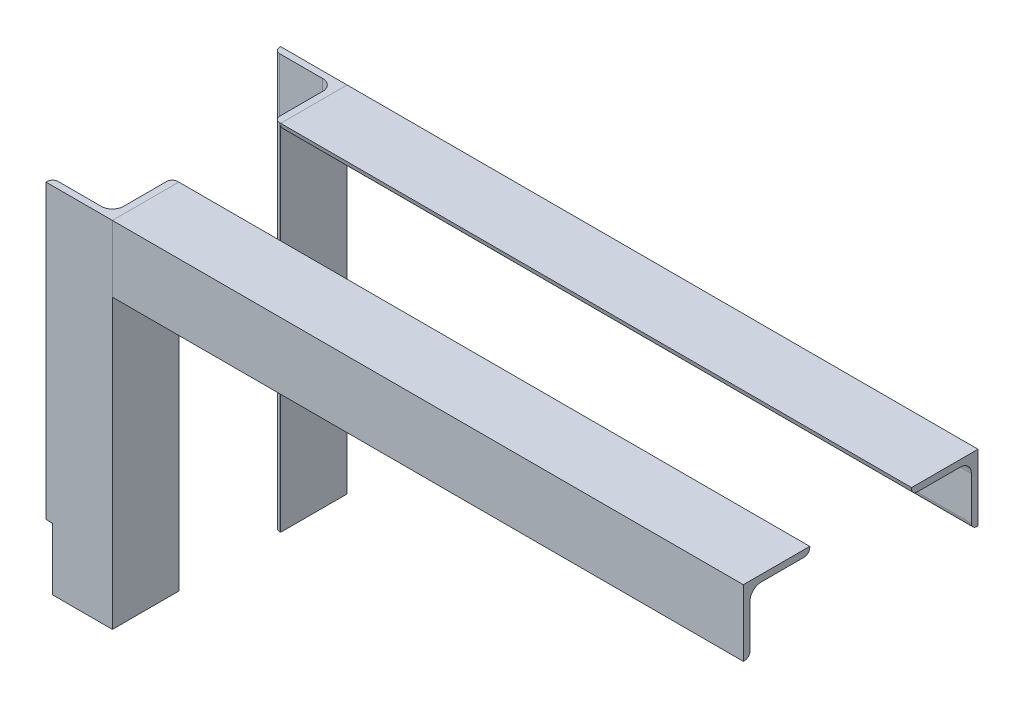
from build123d import *

# Parameters (mm, degrees)
DIN_L_ANGLE_L30X30X3_1_DEPTH   = 285
DIN_L_ANGLE_L30X30X3_1_2_DEPTH = 160
CUT_EXTRUDE1_DEPTH             = 344.600058207
CUT_EXTRUDE1_DEPTH_BACK        = 344.600058207
SKETCH2_W                      = 3
SKETCH2_H                      = 28


# Read off the part's stored shape, not the designer's step: <DIN><l angle><L30x30x3>(1)
with BuildPart() as part:
    # <DIN><l angle><L30x30x3>(1) outline → <DIN><l angle><L30x30x3>(1) (new body)
    with BuildSketch(Plane.YZ):
        with BuildLine():
            Line((130, -53), (160, -53))
            Line((160, -53), (160, -23))
            Line((160, -23), (159.5, -23))
            ThreePointArc((159.5, -23), (157.732233047, -23.732233047), (157, -25.5))
            Line((157, -25.5), (157, -45))
            ThreePointArc((157, -45), (155.535533906, -48.535533906), (152, -50))
            Line((152, -50), (132.5, -50))
            ThreePointArc((132.5, -50), (130.732233047, -50.732233047), (130, -52.5))
            Line((130, -52.5), (130, -53))
        make_face()
        with BuildLine():
            Line((160, 23), (160, 53))
            Line((160, 53), (130, 53))
            Line((130, 53), (130, 52.5))
            ThreePointArc((130, 52.5), (130.732233047, 50.732233047), (132.5, 50))
            Line((132.5, 50), (152, 50))
            ThreePointArc((152, 50), (155.535533906, 48.535533906), (157, 45))
            Line((157, 45), (157, 25.5))
            ThreePointArc((157, 25.5), (157.732233047, 23.732233047), (159.5, 23))
            Line((159.5, 23), (160, 23))
        make_face()
    extrude(amount=DIN_L_ANGLE_L30X30X3_1_DEPTH)


with BuildPart() as body_2:
    # DIN_l angle_L30x30x3_1 2 outline → DIN_l angle_L30x30x3_1 2 (new body)
    with BuildSketch(Plane(origin=(0, 0, 0), x_dir=(1, 0, 0), z_dir=(0, 1, 0))):
        with BuildLine():
            Line((0, 23), (0, 53))
            Line((0, 53), (-30, 53))
            Line((-30, 53), (-30, 52.5))
            ThreePointArc((-30, 52.5), (-29.267766953, 50.732233047), (-27.5, 50))
            Line((-27.5, 50), (-8, 50))
            ThreePointArc((-8, 50), (-4.464466094, 48.535533906), (-3, 45))
            Line((-3, 45), (-3, 25.5))
            ThreePointArc((-3, 25.5), (-2.267766953, 23.732233047), (-0.5, 23))
            Line((-0.5, 23), (0, 23))
        make_face()
        with BuildLine():
            Line((-30, -53), (0, -53))
            Line((0, -53), (0, -23))
            Line((0, -23), (-0.5, -23))
            ThreePointArc((-0.5, -23), (-2.267766953, -23.732233047), (-3, -25.5))
            Line((-3, -25.5), (-3, -45))
            ThreePointArc((-3, -45), (-4.464466094, -48.535533906), (-8, -50))
            Line((-8, -50), (-27.5, -50))
            ThreePointArc((-27.5, -50), (-29.267766953, -50.732233047), (-30, -52.5))
            Line((-30, -52.5), (-30, -53))
        make_face()
    extrude(amount=DIN_L_ANGLE_L30X30X3_1_2_DEPTH)

    # Sketch2 → Cut-Extrude1 (cut, two sides: drawn at the far end of the back side and taken through both)
    with BuildSketch(Plane.XY.offset(53).offset(-CUT_EXTRUDE1_DEPTH_BACK)):
        with Locations((-28.5, 14)):
            Rectangle(SKETCH2_W, SKETCH2_H)
    extrude(amount=CUT_EXTRUDE1_DEPTH + CUT_EXTRUDE1_DEPTH_BACK, mode=Mode.SUBTRACT)


solid = Compound([part.part, body_2.part])
